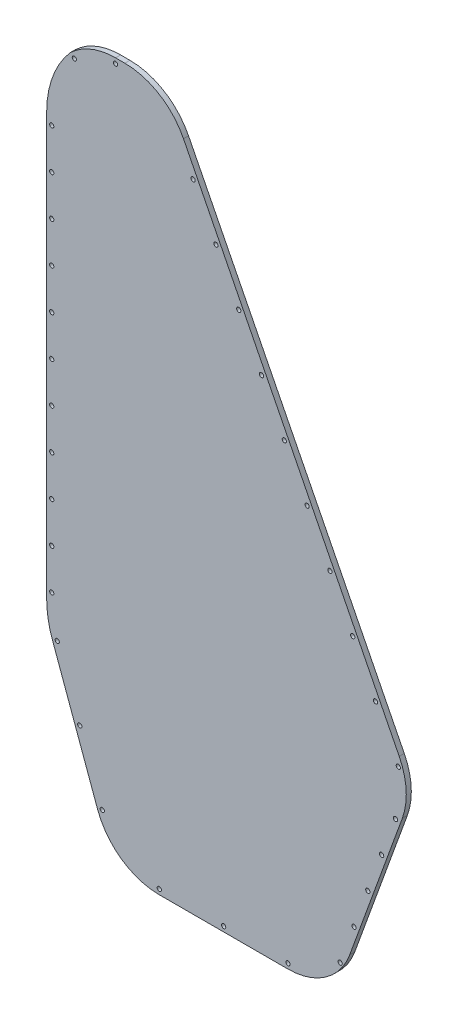
from build123d import *

# Parameters (mm, degrees)
SKETCH1_W           = 720
SKETCH1_H           = 1160
BOSS_EXTRUDE1_DEPTH = 5
FILLET1_R           = 10
CUT_EXTRUDE1_DEPTH  = 683.6602376
SKETCH3_W           = 360
SKETCH3_H           = 360
CUT_EXTRUDE2_DEPTH  = 683.6602376
FILLET2_R           = 100
BOSS_EXTRUDE2_DEPTH = 5
FILLET3_R           = 10
CUT_EXTRUDE5_DEPTH  = 691.712208801
FILLET6_R           = 50
FILLET7_R           = 50
BOSS_EXTRUDE3_DEPTH = 5
SKETCH10_W          = 50
SKETCH10_H          = 680
BOSS_EXTRUDE4_DEPTH = 5
BOSS_EXTRUDE5_DEPTH = 5
FILLET8_R           = 20
FILLET9_R           = 100
FILLET10_R          = 10
SKETCH12_R          = 2.1
CUT_EXTRUDE6_DEPTH  = 691.71220894
FILLET11_R          = 80
SKETCH13_R          = 3.1
CUT_EXTRUDE7_DEPTH  = 691.71220894
SKETCH14_R          = 2.1
CUT_EXTRUDE8_DEPTH  = 691.71220894
SKETCH15_R          = 2.1
CUT_EXTRUDE9_DEPTH  = 691.71220894
SKETCH16_R          = 2.1
CUT_EXTRUDE10_DEPTH = 691.71220894
SKETCH17_R          = 3.1
CUT_EXTRUDE11_DEPTH = 691.71220894
SKETCH18_R          = 2.1
CUT_EXTRUDE12_DEPTH = 691.71220894
CUT_EXTRUDE13_DEPTH = 691.71220894
BOSS_EXTRUDE6_START = -5
BOSS_EXTRUDE6_DEPTH = 5


with BuildPart() as part:
    # Sketch1 → Boss-Extrude1 (new body)
    with BuildSketch(Plane.XY):
        Rectangle(SKETCH1_W, SKETCH1_H)
    extrude(amount=BOSS_EXTRUDE1_DEPTH)

    # Fillet1
    fillet1_edges = [part.edges().sort_by_distance(p)[0] for p in [
        (360, -580, 2.5),
        (-360, -580, 2.5),
        (-360, 580, 2.5),
        (360, 580, 2.5),
    ]]
    fillet(fillet1_edges, radius=FILLET1_R)

    # Sketch2 → Cut-Extrude1 (cut, through all)
    with BuildSketch(Plane(origin=(0, 0, 0), x_dir=(-1, 0, 0), z_dir=(0, 0, -1))):
        Polygon((-360, -400), (110, 580), (-360, 580), align=None)
    extrude(amount=-CUT_EXTRUDE1_DEPTH, mode=Mode.SUBTRACT)

    # Sketch3 → Cut-Extrude2 (cut, through all)
    with BuildSketch(Plane.XY.offset(5)):
        with Locations((-360, 300)):
            Rectangle(SKETCH3_W, SKETCH3_H)
    extrude(amount=-CUT_EXTRUDE2_DEPTH, mode=Mode.SUBTRACT)

    # Fillet2
    fillet2_edges = [part.edges().sort_by_distance(p)[0] for p in [
        (-180, 120, 2.5),
        (-180, 480, 2.5),
    ]]
    fillet(fillet2_edges, radius=FILLET2_R)

    # Sketch4 → Boss-Extrude2 (add)
    with BuildSketch(Plane(origin=(0, 0, 0), x_dir=(-1, 0, 0), z_dir=(0, 0, -1))):
        Polygon((-360, -400), (-381.299239221, -400), (39.887910056, 433.808833734), align=None)
    extrude(amount=-BOSS_EXTRUDE2_DEPTH)

    # Fillet3
    fillet3_edges = [part.edges().sort_by_distance(p)[0] for p in [
        (381.299239221, -400, 2.5),
    ]]
    fillet(fillet3_edges, radius=FILLET3_R)

    # Sketch8 → Cut-Extrude5 (cut, through all)
    with BuildSketch(Plane(origin=(0, 0, 0), x_dir=(-1, 0, 0), z_dir=(0, 0, -1))):
        Polygon((-157.260531971, -145), (-235, -298.897988777), (-163.624705035, -495), (-65, -495), (-65, -145), align=None)
        Polygon((221.746403662, 21.860119087), (105, -298.897988777), (27.260531971, -145), (-157.260531971, -145), (1.937250728, 170.158042579), (61.462906267, 170.158042579), align=None)
        Polygon((27.260531971, -145), (-65, -145), (-65, -495), (33.624705035, -495), (105, -298.897988777), align=None)
    extrude(amount=-CUT_EXTRUDE5_DEPTH, mode=Mode.SUBTRACT)

    # Fillet6
    fillet6_edges = [part.edges().sort_by_distance(p)[0] for p in [
        (-221.746403662, 21.860119087, 2.5),
        (-33.624705035, -495, 2.5),
        (163.624705035, -495, 2.5),
        (235, -298.897988777, 2.5),
        (-61.462906267, 170.158042579, 2.5),
    ]]
    fillet(fillet6_edges, radius=FILLET6_R)

    # Fillet7
    fillet7_edges = [part.edges().sort_by_distance(p)[0] for p in [
        (-1.937250728, 170.158042579, 2.5),
    ]]
    fillet(fillet7_edges, radius=FILLET7_R)

    # Sketch9 → Boss-Extrude3 (add)
    with BuildSketch(Plane(origin=(0, 0, 0), x_dir=(-1, 0, 0), z_dir=(0, 0, -1))):
        Polygon((130, 100), (110, 100), (110, -285.160601679), (130, -230.21105329), align=None)
        Polygon((110, 120), (110, 100), (130, 100), (137.291186057, 100), (115.674767753, 120), align=None)
    extrude(amount=-BOSS_EXTRUDE3_DEPTH)

    # Sketch10 → Boss-Extrude4 (add)
    with BuildSketch(Plane(origin=(0, 0, 0), x_dir=(-1, 0, 0), z_dir=(0, 0, -1))):
        with Locations((120, -65.105526645)):
            Rectangle(SKETCH10_W, SKETCH10_H)
    extrude(amount=-BOSS_EXTRUDE4_DEPTH)

    # Sketch11 → Boss-Extrude5 (add)
    with BuildSketch(Plane(origin=(0, 0, 0), x_dir=(-1, 0, 0), z_dir=(0, 0, -1))):
        Polygon((145, 10.590837072), (187.73624833, 53.327085402), (145, 92.867630674), align=None)
    extrude(amount=-BOSS_EXTRUDE5_DEPTH)

    # Fillet8
    fillet8_edges = [part.edges().sort_by_distance(p)[0] for p in [
        (-187.73624833, 53.327085402, 2.5),
    ]]
    fillet(fillet8_edges, radius=FILLET8_R)

    # Fillet9
    # the kernel refuses this fillet: 100 mm, written as the material it adds along each edge
    with BuildSketch(Plane(origin=(-145, 10.590837072, 0), x_dir=(-0.7071067811865508, 0.7071067811865444, 0), z_dir=(0, 0, 1))) as fillet9_piece_1:
        with BuildLine():
            CenterArc((41.425014476, 99.996341761), FILLET9_R, 225, 44.509910946)
            Line((-29.285663642, 29.285663642), (-30.699877205, 27.87145008))
            Line((-30.699877205, 27.87145008), (-1.414213562, -1.414213562))
            Line((-1.414213562, -1.414213562), (0, -2))
            Line((0, -2), (40.552551018, -1.999926835))
            Line((40.552551018, -1.999926835), (40.569658144, 0))
        make_face()
    extrude(amount=5)

    # Fillet10
    fillet10_edges = [part.edges().sort_by_distance(p)[0] for p in [
        (-145, -188.998891999, 2.5),
    ]]
    fillet(fillet10_edges, radius=FILLET10_R)

    # Sketch12 → Cut-Extrude6 (cut, through all)
    with BuildSketch(Plane(origin=(0, 0, 0), x_dir=(-1, 0, 0), z_dir=(0, 0, -1))):
        with Locations((-237.732802544, -282.129047053)):
            Circle(SKETCH12_R)
        with Locations((-215.18892551, -237.49975613)):
            Circle(SKETCH12_R)
        with Locations((-192.645048475, -192.870465208)):
            Circle(SKETCH12_R)
        with Locations((-170.101171441, -148.241174285)):
            Circle(SKETCH12_R)
        with Locations((-147.557294406, -103.611883362)):
            Circle(SKETCH12_R)
        with Locations((-125.013417372, -58.98259244)):
            Circle(SKETCH12_R)
        with Locations((-102.469540337, -14.353301517)):
            Circle(SKETCH12_R)
        with Locations((-79.925663303, 30.275989405)):
            Circle(SKETCH12_R)
        with Locations((-57.381786268, 74.905280328)):
            Circle(SKETCH12_R)
        with Locations((-34.837909234, 119.534571251)):
            Circle(SKETCH12_R)
    extrude(amount=-CUT_EXTRUDE6_DEPTH, mode=Mode.SUBTRACT)

    # Fillet11
    # the kernel refuses this fillet: 80 mm, written as the material it adds along each edge
    with BuildSketch(Plane(origin=(-95, -326.372762971, 5), x_dir=(0.34202014332567043, -0.9396926207859078, 0), z_dir=(0, 0, -1))) as fillet11_piece_1:
        with BuildLine():
            CenterArc((FILLET11_R * 0.176326980708, -FILLET11_R), FILLET11_R, 90, 20)
            Line((-FILLET11_R * 0.165693162617, -FILLET11_R * 0.0603073792141), (0, 0))
            Line((0, 0), (FILLET11_R * 0.176326980708, 0))
        make_face()
    extrude(amount=5)
    with BuildSketch(Plane(origin=(-95, 139.128763573, 0), x_dir=(0, -1, 0), z_dir=(0, 0, 1))) as fillet11_piece_2:
        with BuildLine():
            CenterArc((34.220542128, 80), FILLET11_R, 229.504826403, 40.495173597)
            Line((-17.730177232, 19.163146383), (0, 0))
            Line((0, 0), (34.220542128, 0))
        make_face()
    extrude(amount=5)

    # Sketch13 → Cut-Extrude7 (cut, through all)
    with BuildSketch(Plane(origin=(0, 0, 0), x_dir=(-1, 0, 0), z_dir=(0, 0, -1))):
        with Locations((-295.119528739, -258.298431639)):
            Circle(SKETCH13_R)
        with Locations((-326.902073438, -318.41390263)):
            Circle(SKETCH13_R)
    extrude(amount=-CUT_EXTRUDE7_DEPTH, mode=Mode.SUBTRACT)

    # Sketch14 → Cut-Extrude8 (cut, through all)
    with BuildSketch(Plane.XY.offset(5)):
        with Locations((-340, 110)):
            Circle(SKETCH14_R)
        with Locations((-300, 110)):
            Circle(SKETCH14_R)
        with Locations((-260, 110)):
            Circle(SKETCH14_R)
        with Locations((-220, 110)):
            Circle(SKETCH14_R)
        with Locations((-180, 110)):
            Circle(SKETCH14_R)
        with Locations((-140, 110)):
            Circle(SKETCH14_R)
    extrude(amount=-CUT_EXTRUDE8_DEPTH, mode=Mode.SUBTRACT)

    # Sketch15 → Cut-Extrude9 (cut, through all)
    with BuildSketch(Plane.XY.offset(5)):
        with Locations((-350, -570)):
            Circle(SKETCH15_R)
        with Locations((-350, -530)):
            Circle(SKETCH15_R)
        with Locations((-350, -490)):
            Circle(SKETCH15_R)
        with Locations((-350, -450)):
            Circle(SKETCH15_R)
        with Locations((-350, -410)):
            Circle(SKETCH15_R)
        with Locations((-350, -370)):
            Circle(SKETCH15_R)
        with Locations((-350, -330)):
            Circle(SKETCH15_R)
        with Locations((-350, -290)):
            Circle(SKETCH15_R)
        with Locations((-350, -250)):
            Circle(SKETCH15_R)
        with Locations((-350, -210)):
            Circle(SKETCH15_R)
        with Locations((-350, -170)):
            Circle(SKETCH15_R)
        with Locations((-350, -130)):
            Circle(SKETCH15_R)
        with Locations((-350, -90)):
            Circle(SKETCH15_R)
        with Locations((-350, -50)):
            Circle(SKETCH15_R)
        with Locations((-350, -10)):
            Circle(SKETCH15_R)
        with Locations((-350, 30)):
            Circle(SKETCH15_R)
        with Locations((-350, 70)):
            Circle(SKETCH15_R)
        with Locations((-350, 110)):
            Circle(SKETCH15_R)
        with Locations((-120, -570)):
            Circle(SKETCH15_R)
        with Locations((-120, -530)):
            Circle(SKETCH15_R)
        with Locations((-120, -490)):
            Circle(SKETCH15_R)
        with Locations((-120, -450)):
            Circle(SKETCH15_R)
        with Locations((-120, -410)):
            Circle(SKETCH15_R)
        with Locations((-120, -370)):
            Circle(SKETCH15_R)
        with Locations((-120, -330)):
            Circle(SKETCH15_R)
        with Locations((-120, -290)):
            Circle(SKETCH15_R)
        with Locations((-120, -250)):
            Circle(SKETCH15_R)
        with Locations((-120, -210)):
            Circle(SKETCH15_R)
        with Locations((-120, -170)):
            Circle(SKETCH15_R)
        with Locations((-120, -130)):
            Circle(SKETCH15_R)
        with Locations((-120, -90)):
            Circle(SKETCH15_R)
        with Locations((-120, -50)):
            Circle(SKETCH15_R)
        with Locations((-120, -10)):
            Circle(SKETCH15_R)
        with Locations((-120, 30)):
            Circle(SKETCH15_R)
        with Locations((-120, 70)):
            Circle(SKETCH15_R)
        with Locations((-120, 110)):
            Circle(SKETCH15_R)
    extrude(amount=-CUT_EXTRUDE9_DEPTH, mode=Mode.SUBTRACT)

    # Sketch16 → Cut-Extrude10 (cut, through all)
    with BuildSketch(Plane.XY.offset(5)):
        with Locations((-315, -570)):
            Circle(SKETCH16_R)
        with Locations((-280, -570)):
            Circle(SKETCH16_R)
        with Locations((-245, -570)):
            Circle(SKETCH16_R)
        with Locations((-210, -570)):
            Circle(SKETCH16_R)
        with Locations((-175, -570)):
            Circle(SKETCH16_R)
        with Locations((-140, -570)):
            Circle(SKETCH16_R)
        with Locations((-105, -570)):
            Circle(SKETCH16_R)
        with Locations((-70, -570)):
            Circle(SKETCH16_R)
        with Locations((-35, -570)):
            Circle(SKETCH16_R)
        with Locations((0, -570)):
            Circle(SKETCH16_R)
        with Locations((35, -570)):
            Circle(SKETCH16_R)
        with Locations((70, -570)):
            Circle(SKETCH16_R)
        with Locations((105, -570)):
            Circle(SKETCH16_R)
        with Locations((140, -570)):
            Circle(SKETCH16_R)
        with Locations((175, -570)):
            Circle(SKETCH16_R)
        with Locations((210, -570)):
            Circle(SKETCH16_R)
        with Locations((245, -570)):
            Circle(SKETCH16_R)
        with Locations((280, -570)):
            Circle(SKETCH16_R)
        with Locations((315, -570)):
            Circle(SKETCH16_R)
        with Locations((350, -570)):
            Circle(SKETCH16_R)
    extrude(amount=-CUT_EXTRUDE10_DEPTH, mode=Mode.SUBTRACT)

    # Sketch17 → Cut-Extrude11 (cut, through all)
    with BuildSketch(Plane(origin=(0, 0, 0), x_dir=(-1, 0, 0), z_dir=(0, 0, -1))):
        with Locations((-335, -410)):
            Circle(SKETCH17_R)
        with Locations((-335, -450)):
            Circle(SKETCH17_R)
        with Locations((-335, -490)):
            Circle(SKETCH17_R)
        with Locations((-335, -530)):
            Circle(SKETCH17_R)
    extrude(amount=-CUT_EXTRUDE11_DEPTH, mode=Mode.SUBTRACT)

    # Sketch18 → Cut-Extrude12 (cut, through all)
    with BuildSketch(Plane(origin=(0, 0, 0), x_dir=(-1, 0, 0), z_dir=(0, 0, -1))):
        with Locations((-234.944538726, -328.288411377)):
            Circle(SKETCH18_R)
        with Locations((-221.263732993, -365.876116209)):
            Circle(SKETCH18_R)
        with Locations((-207.58292726, -403.46382104)):
            Circle(SKETCH18_R)
        with Locations((-193.902121527, -441.051525871)):
            Circle(SKETCH18_R)
        with Locations((-180.221315794, -478.639230703)):
            Circle(SKETCH18_R)
        with Locations((-128.614328125, -505)):
            Circle(SKETCH18_R)
        with Locations((-65, -505)):
            Circle(SKETCH18_R)
        with Locations((-1.385671875, -505)):
            Circle(SKETCH18_R)
        with Locations((54.995885372, -465.5212086)):
            Circle(SKETCH18_R)
        with Locations((77.284110621, -404.284813007)):
            Circle(SKETCH18_R)
        with Locations((99.572335871, -343.048417414)):
            Circle(SKETCH18_R)
        with Locations((105, -304.266604515)):
            Circle(SKETCH18_R)
        with Locations((105, -264.266604515)):
            Circle(SKETCH18_R)
        with Locations((105, -224.266604515)):
            Circle(SKETCH18_R)
        with Locations((105, -184.266604515)):
            Circle(SKETCH18_R)
        with Locations((105, -144.266604515)):
            Circle(SKETCH18_R)
        with Locations((105, -104.266604515)):
            Circle(SKETCH18_R)
        with Locations((105, -64.266604515)):
            Circle(SKETCH18_R)
        with Locations((105, -24.266604515)):
            Circle(SKETCH18_R)
        with Locations((105, 15.733395485)):
            Circle(SKETCH18_R)
        with Locations((105, 55.733395485)):
            Circle(SKETCH18_R)
        with Locations((105, 95.733395485)):
            Circle(SKETCH18_R)
        with Locations((41.880351009, 180.158042579)):
            Circle(SKETCH18_R)
        with Locations((82.628154139, 164.199120451)):
            Circle(SKETCH18_R)
    extrude(amount=-CUT_EXTRUDE12_DEPTH, mode=Mode.SUBTRACT)

    # Sketch19 → Cut-Extrude13 (cut, through all)
    with BuildSketch(Plane(origin=(0, 0, 0), x_dir=(-1, 0, 0), z_dir=(0, 0, -1))):
        with BuildLine():
            Line((39.887910056, 433.808833734), (-373.970329397, -385.491224593))
            ThreePointArc((-373.970329397, -385.491224593), (-373.561740554, -395.23985906), (-365.044471212, -400))
            Line((-365.044471212, -400), (-360, -400))
            Line((-360, -400), (-360, -570))
            ThreePointArc((-360, -570), (-357.071067812, -577.071067812), (-350, -580))
            Line((-350, -580), (350, -580))
            ThreePointArc((350, -580), (357.071067812, -577.071067812), (360, -570))
            Line((360, -570), (360, 120))
            Line((360, 120), (280, 120))
            ThreePointArc((280, 120), (209.289321881, 149.289321881), (180, 220))
            Line((180, 220), (180, 380))
            ThreePointArc((180, 380), (209.289321881, 450.710678119), (280, 480))
            Line((280, 480), (360, 480))
            Line((360, 480), (360, 570))
            ThreePointArc((360, 570), (357.071067812, 577.071067812), (350, 580))
            Line((350, 580), (110, 580))
            Line((110, 580), (39.887910056, 433.808833734))
        make_face()
        with BuildLine():
            Line((-241.69512269, -324.360356369), (-189.694348476, -467.231309316))
            ThreePointArc((-189.694348476, -467.231309316), (-165.896796487, -498.244882879), (-128.614328125, -510))
            Line((-128.614328125, -510), (-1.385671875, -510))
            ThreePointArc((-1.385671875, -510), (35.896796487, -498.244882879), (59.694348476, -467.231309316))
            Line((59.694348476, -467.231309316), (104.270798975, -344.758518131))
            ThreePointArc((104.270798975, -344.758518131), (108.556736536, -328.763181393), (110, -312.266604515))
            Line((110, -312.266604515), (110, 104.908221446))
            ThreePointArc((110, 104.908221446), (103.979550556, 138.189441117), (86.681271941, 167.2523892))
            ThreePointArc((86.681271941, 167.2523892), (66.003653743, 180.515861171), (41.880351009, 185.158042579))
            Line((41.880351009, 185.158042579), (32.697455963, 185.158042579))
            ThreePointArc((32.697455963, 185.158042579), (-1.361627925, 175.520293298), (-25.320622236, 149.465082723))
            Line((-25.320622236, 149.465082723), (-238.633180538, -272.822006908))
            ThreePointArc((-238.633180538, -272.822006908), (-245.500691154, -298.27413277), (-241.69512269, -324.360356369))
        make_face(mode=Mode.SUBTRACT)
    extrude(amount=-CUT_EXTRUDE13_DEPTH, mode=Mode.SUBTRACT)

    # Sketch20 → Boss-Extrude6 (add)
    with BuildSketch(Plane(origin=(0, 0, 0), x_dir=(-1, 0, 0), z_dir=(0, 0, -1)).offset(BOSS_EXTRUDE6_START)):
        with BuildLine():
            Line((95, 104.908221446), (95, -312.266604515))
            ThreePointArc((95, -312.266604515), (93.784620241, -326.158458728), (90.175409663, -339.628215981))
            Line((90.175409663, -339.628215981), (45.598959164, -462.101007166))
            ThreePointArc((45.598959164, -462.101007166), (27.293149942, -485.957602214), (-1.385671875, -495))
            Line((-1.385671875, -495), (-128.614328125, -495))
            ThreePointArc((-128.614328125, -495), (-157.293149942, -485.957602214), (-175.598959164, -462.101007166))
            Line((-175.598959164, -462.101007166), (-227.599733378, -319.230054219))
            ThreePointArc((-227.599733378, -319.230054219), (-230.527093735, -299.163728374), (-225.244393261, -279.585170018))
            Line((-225.244393261, -279.585170018), (-11.931834959, 142.701919613))
            ThreePointArc((-11.931834959, 142.701919613), (6.498160665, 162.744389286), (32.697455963, 170.158042579))
            Line((32.697455963, 170.158042579), (41.880351009, 170.158042579))
            ThreePointArc((41.880351009, 170.158042579), (60.114317784, 166.714701132), (75.836853617, 156.858940805))
            ThreePointArc((75.836853617, 156.858940805), (90.056473037, 132.594424785), (95, 104.908221446))
        make_face()
    extrude(amount=BOSS_EXTRUDE6_DEPTH)


solid = part.part
